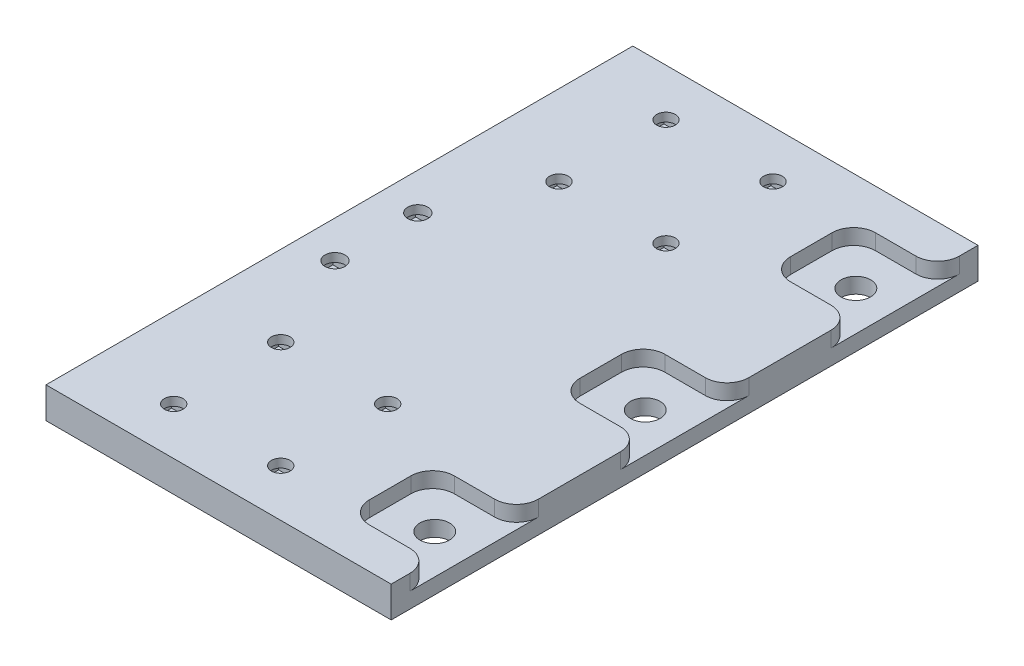
from build123d import *

# Parameters (mm, degrees)
SKETCH1_W                       = 50
SKETCH1_H                       = 95
BOSS_EXTRUDE1_DEPTH             = 2.25
M2_5_CLEARANCE_HOLE1_AT_2_COUNT = 2
M2_5_CLEARANCE_HOLE1_AT_2_PITCH = 15.5
M2_5_CLEARANCE_HOLE1_AT_3_COUNT = 2
M2_5_CLEARANCE_HOLE1_AT_3_PITCH = 21.920310217
M2_5_CLEARANCE_HOLE1_AT_4_COUNT = 2
M2_5_CLEARANCE_HOLE1_AT_4_PITCH = 15.5
SKETCH4_W                       = 50
SKETCH4_H                       = 5
CUT_EXTRUDE1_DEPTH              = 54.865573421
CUT_EXTRUDE2_DEPTH              = 2.25
M4_CLEARANCE_HOLE1_D            = 4.3
M4_CLEARANCE_HOLE1_DEPTH        = 10.1
M4_CLEARANCE_HOLE1_TIP          = 1.291850331
FILLET1_R                       = 3.1524
M2_5_CLEARANCE_HOLE2_D          = 2.9
SKETCH10_W                      = 5.7548
SKETCH10_H                      = 5.1548
CUT_EXTRUDE3_DEPTH              = 1


with BuildPart() as part:
    # Sketch1 → Boss-Extrude1 (new, symmetric)
    with BuildSketch(Plane(origin=(0, 0, 0), x_dir=(1, 0, 0), z_dir=(0, 1, 0))):
        Rectangle(SKETCH1_W, SKETCH1_H)
    extrude(amount=BOSS_EXTRUDE1_DEPTH, both=True)

    # Sketch3 → M2.5 Clearance Hole1 (revolve, cut)
    with BuildSketch(Plane(origin=(2.15, 2.25, 20.15), x_dir=(0, 0, 1), z_dir=(1, 0, 0))):
        Polygon((0, 0), (0, 7.161161836), (1.35, 6.35), (1.35, 0), align=None)
    m2_5_clearance_hole1 = revolve(axis=Axis((2.15, 8.6, 20.15), (0, -1, 0)), mode=Mode.SUBTRACT)

    # M2.5 Clearance Hole1 at 2: M2.5 Clearance Hole1 ×2
    with Locations(*[(0, 0, i * M2_5_CLEARANCE_HOLE1_AT_2_PITCH) for i in range(1, M2_5_CLEARANCE_HOLE1_AT_2_COUNT)]):
        add(m2_5_clearance_hole1, mode=Mode.SUBTRACT)

    # M2.5 Clearance Hole1 at 3: M2.5 Clearance Hole1 ×2
    with Locations(*[Vector(-0.7071067811865477, 0, 0.7071067811865475) * (i * M2_5_CLEARANCE_HOLE1_AT_3_PITCH) for i in range(1, M2_5_CLEARANCE_HOLE1_AT_3_COUNT)]):
        add(m2_5_clearance_hole1, mode=Mode.SUBTRACT)

    # M2.5 Clearance Hole1 at 4: M2.5 Clearance Hole1 ×2
    with Locations(*[(-i * M2_5_CLEARANCE_HOLE1_AT_4_PITCH, 0, 0) for i in range(1, M2_5_CLEARANCE_HOLE1_AT_4_COUNT)]):
        add(m2_5_clearance_hole1, mode=Mode.SUBTRACT)

    # Sketch4 → Cut-Extrude1 (cut, through all)
    with BuildSketch(Plane(origin=(0, 2.25, 0), x_dir=(1, 0, 0), z_dir=(0, 1, 0))):
        with Locations((0, -45)):
            Rectangle(SKETCH4_W, SKETCH4_H)
    cut_extrude1 = extrude(amount=-CUT_EXTRUDE1_DEPTH, mode=Mode.SUBTRACT)

    # Mirror1: M2.5 Clearance Hole1, Cut-Extrude1 across plane
    add(m2_5_clearance_hole1.mirror(Plane.XY), mode=Mode.SUBTRACT)
    add(cut_extrude1.mirror(Plane.XY), mode=Mode.SUBTRACT)

    # Mirror1 copy 1 sketch → Mirror1 copy 1 (revolve, cut)
    with BuildSketch(Plane(origin=(2.15, 2.25, -35.65), x_dir=(0, 0, -1), z_dir=(1, 0, 0))):
        Polygon((0, 0), (0, -7.161161836), (1.35, -6.35), (1.35, 0), align=None)
    revolve(axis=Axis((2.15, 8.6, -35.65), (0, 1, 0)), mode=Mode.SUBTRACT)

    # Mirror1 copy 2 sketch → Mirror1 copy 2 (revolve, cut)
    with BuildSketch(Plane(origin=(-13.35, 2.25, -35.65), x_dir=(0, 0, -1), z_dir=(1, 0, 0))):
        Polygon((0, 0), (0, -7.161161836), (1.35, -6.35), (1.35, 0), align=None)
    revolve(axis=Axis((-13.35, 8.6, -35.65), (0, 1, 0)), mode=Mode.SUBTRACT)

    # Mirror1 copy 3 sketch → Mirror1 copy 3 (revolve, cut)
    with BuildSketch(Plane(origin=(-13.35, 2.25, -20.15), x_dir=(0, 0, -1), z_dir=(1, 0, 0))):
        Polygon((0, 0), (0, -7.161161836), (1.35, -6.35), (1.35, 0), align=None)
    revolve(axis=Axis((-13.35, 8.6, -20.15), (0, 1, 0)), mode=Mode.SUBTRACT)

    # Sketch5 → Cut-Extrude2 (cut)
    with BuildSketch(Plane(origin=(0, 2.25, 0), x_dir=(1, 0, 0), z_dir=(0, 1, 0))):
        with BuildLine():
            Line((25, -36.6524), (16, -36.6524))
            ThreePointArc((16, -36.6524), (13.770916583, -35.729083417), (12.8476, -33.5))
            Line((12.8476, -33.5), (12.8476, -27.5))
            ThreePointArc((12.8476, -27.5), (13.770916583, -25.270916583), (16, -24.3476))
            Line((16, -24.3476), (25, -24.3476))
            Line((25, -24.3476), (25, -36.6524))
        make_face()
        with BuildLine():
            Line((25, 6.1524), (25, -6.1524))
            Line((25, -6.1524), (16, -6.1524))
            ThreePointArc((16, -6.1524), (13.770916583, -5.229083417), (12.8476, -3))
            Line((12.8476, -3), (12.8476, 3))
            ThreePointArc((12.8476, 3), (13.770916583, 5.229083417), (16, 6.1524))
            Line((16, 6.1524), (25, 6.1524))
        make_face()
        with BuildLine():
            Line((25, 36.6524), (25, 24.3476))
            Line((25, 24.3476), (16, 24.3476))
            ThreePointArc((16, 24.3476), (13.770916583, 25.270916583), (12.8476, 27.5))
            Line((12.8476, 27.5), (12.8476, 33.5))
            ThreePointArc((12.8476, 33.5), (13.770916583, 35.729083417), (16, 36.6524))
            Line((16, 36.6524), (25, 36.6524))
        make_face()
    extrude(amount=-CUT_EXTRUDE2_DEPTH, mode=Mode.SUBTRACT)

    # M4 Clearance Hole1
    with Locations(Plane(origin=(0, 0, 0), x_dir=(1, 0, 0), z_dir=(0, 1, 0))):
        with Locations((19.3048, -30.5), (19.3048, 0), (19.3048, 30.5)):
            Hole(M4_CLEARANCE_HOLE1_D / 2, depth=M4_CLEARANCE_HOLE1_DEPTH)
            with Locations((0, 0, -(M4_CLEARANCE_HOLE1_DEPTH + M4_CLEARANCE_HOLE1_TIP / 2))):  # 118° drill point
                Cone(0, M4_CLEARANCE_HOLE1_D / 2, M4_CLEARANCE_HOLE1_TIP, mode=Mode.SUBTRACT)

    # Fillet1
    fillet1_edges = [part.edges().sort_by_distance(p)[0] for p in [
        (25, 1.125, -36.6524),
        (25, 1.125, -24.3476),
        (25, 1.125, -6.1524),
        (25, 1.125, 6.1524),
        (25, 1.125, 24.3476),
        (25, 1.125, 36.6524),
    ]]
    fillet(fillet1_edges, radius=FILLET1_R)

    # M2.5 Clearance Hole2 (through all)
    with Locations(Plane(origin=(0, -2.25, 0), x_dir=(-1, 0, 0), z_dir=(0, -1, 0))):
        with Locations((19.641987941, 6), (19.641987941, -6)):
            Hole(M2_5_CLEARANCE_HOLE2_D / 2)

    # Sketch10 → Cut-Extrude3 (cut, symmetric)
    with BuildSketch(Plane(origin=(0, 0, 0), x_dir=(1, 0, 0), z_dir=(0, 1, 0))):
        with Locations((-13.35, -20.15)):
            Rectangle(SKETCH10_W, SKETCH10_H)
        with Locations((2.15, -20.15)):
            Rectangle(SKETCH10_W, SKETCH10_H)
        with Locations((-13.35, -35.65)):
            Rectangle(SKETCH10_W, SKETCH10_H)
        with Locations((2.15, -35.65)):
            Rectangle(SKETCH10_W, SKETCH10_H)
        with Locations((2.15, 35.65)):
            Rectangle(SKETCH10_W, SKETCH10_H)
        with Locations((-13.35, 35.65)):
            Rectangle(SKETCH10_W, SKETCH10_H)
        with Locations((2.15, 20.15)):
            Rectangle(SKETCH10_W, SKETCH10_H)
        with Locations((-13.35, 20.15)):
            Rectangle(SKETCH10_W, SKETCH10_H)
        with Locations((-19.641987941, -6)):
            Rectangle(SKETCH10_W, SKETCH10_H)
        with Locations((-19.641987941, 6)):
            Rectangle(SKETCH10_W, SKETCH10_H)
    extrude(amount=CUT_EXTRUDE3_DEPTH, both=True, mode=Mode.SUBTRACT)


solid = part.part
